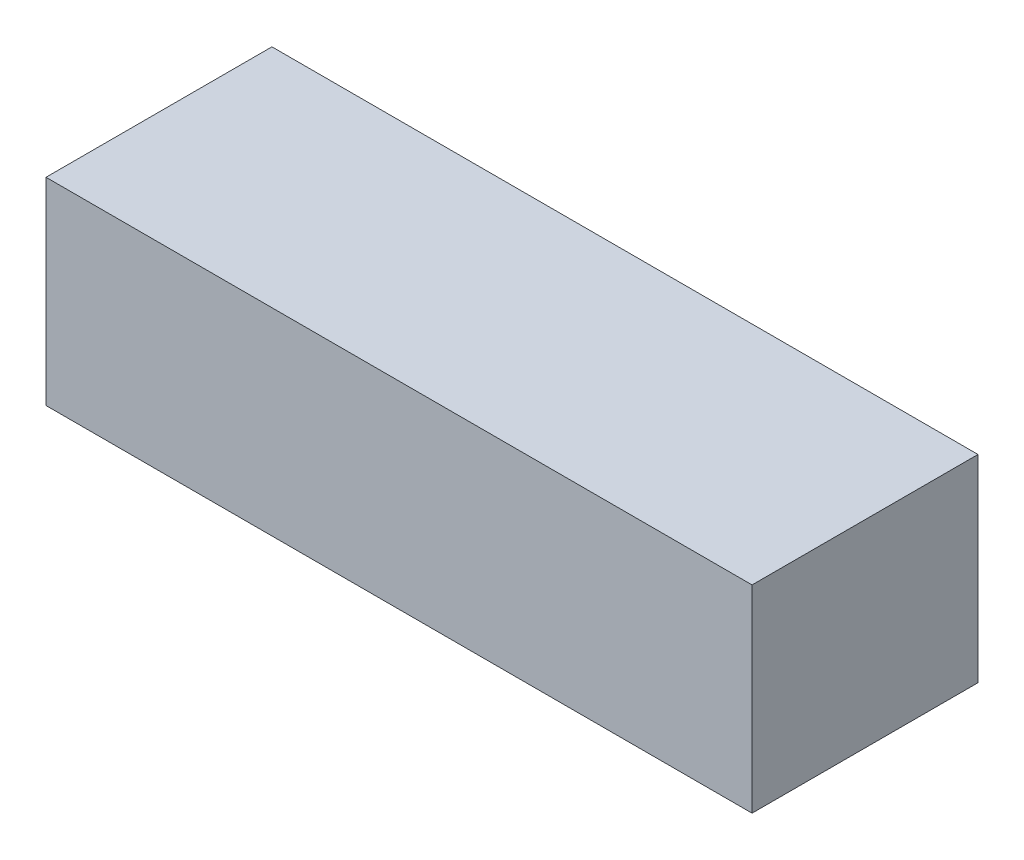
from build123d import *

# Parameters (mm, degrees)
SKETCH_1_W      = 25
SKETCH_1_H      = 8
EXTRUDE_1_DEPTH = 7


with BuildPart() as part:
    # 草图1 → 凸台-拉伸1 (new body)
    with BuildSketch(Plane(origin=(0, 0, 0), x_dir=(1, 0, 0), z_dir=(0, 1, 0))):
        Rectangle(SKETCH_1_W, SKETCH_1_H)
    extrude(amount=EXTRUDE_1_DEPTH)


solid = part.part
